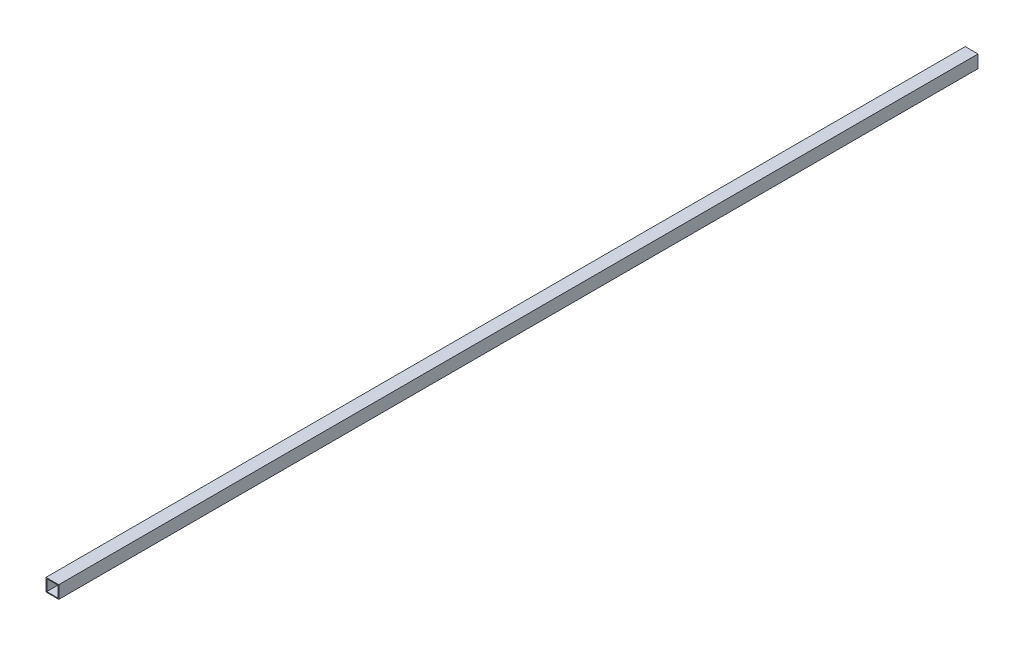
from build123d import *

# Parameters (mm, degrees)
SKETCH1_W           = 25.4
SKETCH1_H           = 25.4
SKETCH1_W_2         = 22.225
SKETCH1_H_2         = 22.225
BOSS_EXTRUDE1_DEPTH = 1828.8


with BuildPart() as part:
    # Sketch1 → Boss-Extrude1 (new body)
    with BuildSketch(Plane.XY):
        Rectangle(SKETCH1_W, SKETCH1_H)
        Rectangle(SKETCH1_W_2, SKETCH1_H_2, mode=Mode.SUBTRACT)
    extrude(amount=BOSS_EXTRUDE1_DEPTH)


solid = part.part
